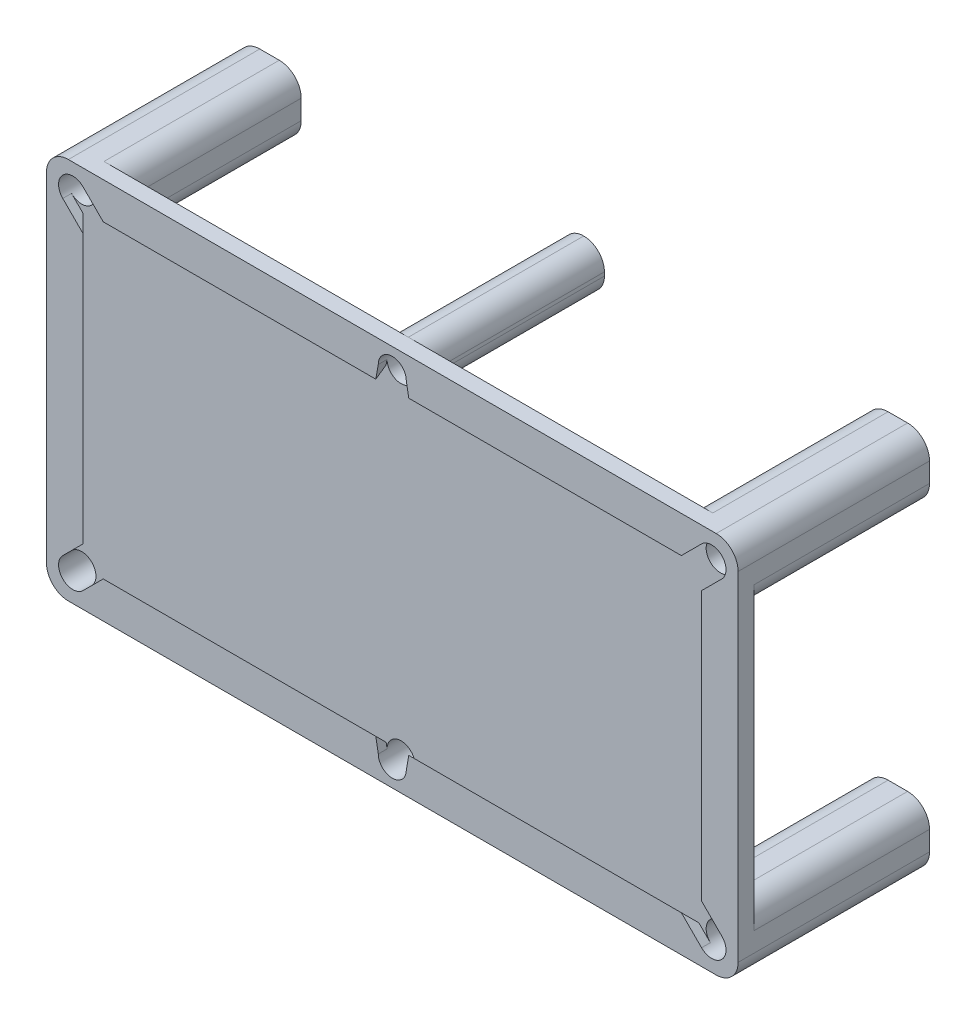
from build123d import *

# Parameters (mm, degrees)
SZKIC1_W                    = 2840
SZKIC1_H                    = 1570
SZKIC1_W_2                  = 2540
SZKIC1_H_2                  = 1270
DODANIE_WYCI_GNI_CIE1_DEPTH = 36
SFAZOWANIE1_SIZE            = 36
SZKIC3_W                    = 2840
SZKIC3_H                    = 1570
DODANIE_WYCI_GNI_CIE3_DEPTH = 30
SZKIC5_W                    = 260
SZKIC5_H                    = 260
DODANIE_WYCI_GNI_CIE4_DEPTH = 720
WYTNIJ_WYCI_GNI_CIE16_DEPTH = 36
SZKIC8_R                    = 58.75
WYTNIJ_WYCI_GNI_CIE17_DEPTH = 700
ZAOKR_GLENIE1_R             = 90
WYTNIJ_WYCI_GNI_CIE18_DEPTH = 36
SZKIC11_W                   = 170
SZKIC11_H                   = 185
DODANIE_WYCI_GNI_CIE5_DEPTH = 720
ZAOKR_GLENIE2_R             = 85
SZKIC10_R                   = 57.5
WYTNIJ_WYCI_GNI_CIE19_DEPTH = 700


with BuildPart() as part:
    # Szkic1 → Dodanie-wyciągnięcie1 (new body)
    with BuildSketch(Plane.XY):
        Rectangle(SZKIC1_W, SZKIC1_H)
        Rectangle(SZKIC1_W_2, SZKIC1_H_2, mode=Mode.SUBTRACT)
    extrude(amount=DODANIE_WYCI_GNI_CIE1_DEPTH)

    # Sfazowanie1
    sfazowanie1_edges = [part.edges().sort_by_distance(p)[0] for p in [
        (-1270, 0, 0),
        (0, -635, 0),
        (1270, 0, 0),
        (0, 635, 0),
    ]]
    chamfer(sfazowanie1_edges, length=SFAZOWANIE1_SIZE - 0.0001)  # a hair under: the kernel refuses the full size

    # Szkic3 → Dodanie-wyciągnięcie3 (add)
    with BuildSketch(Plane(origin=(0, 0, 0), x_dir=(-1, 0, 0), z_dir=(0, 0, -1))):
        Rectangle(SZKIC3_W, SZKIC3_H)
    extrude(amount=DODANIE_WYCI_GNI_CIE3_DEPTH)

    # Szkic5 → Dodanie-wyciągnięcie4 (add)
    with BuildSketch(Plane(origin=(0, 0, -30), x_dir=(-1, 0, 0), z_dir=(0, 0, -1))):
        with Locations((-1290, 655)):
            Rectangle(SZKIC5_W, SZKIC5_H)
        with Locations((1290, 655)):
            Rectangle(SZKIC5_W, SZKIC5_H)
        with Locations((1290, -655)):
            Rectangle(SZKIC5_W, SZKIC5_H)
        with Locations((-1290, -655)):
            Rectangle(SZKIC5_W, SZKIC5_H)
    extrude(amount=DODANIE_WYCI_GNI_CIE4_DEPTH)

    # Szkic4 → Wytnij-wyciągnięcie16 (cut)
    with BuildSketch(Plane.XY.offset(36)):
        with BuildLine():
            Line((-1270, 635), (-1186.914953211, 635))
            Line((-1186.914953211, 635), (-1270, 718.085046789))
            ThreePointArc((-1270, 718.085046789), (-1353.085046789, 718.085046789), (-1353.085046789, 635))
            Line((-1353.085046789, 635), (-1270, 551.914953211))
            Line((-1270, 551.914953211), (-1270, 635))
        make_face()
        with BuildLine():
            Line((1270, 718.085046789), (1186.914953211, 635))
            Line((1186.914953211, 635), (1270, 635))
            Line((1270, 635), (1270, 551.914953211))
            Line((1270, 551.914953211), (1353.085046789, 635))
            ThreePointArc((1353.085046789, 635), (1353.085046789, 718.085046789), (1270, 718.085046789))
        make_face()
        with BuildLine():
            Line((-1270, -635), (-1270, -551.914953211))
            Line((-1270, -551.914953211), (-1353.085046789, -635))
            ThreePointArc((-1353.085046789, -635), (-1353.085046789, -718.085046789), (-1270, -718.085046789))
            Line((-1270, -718.085046789), (-1186.914953211, -635))
            Line((-1186.914953211, -635), (-1270, -635))
        make_face()
        with BuildLine():
            Line((1353.085046789, -635), (1270, -551.914953211))
            Line((1270, -551.914953211), (1270, -635))
            Line((1270, -635), (1186.914953211, -635))
            Line((1186.914953211, -635), (1270, -718.085046789))
            ThreePointArc((1270, -718.085046789), (1353.085046789, -718.085046789), (1353.085046789, -635))
        make_face()
    extrude(amount=-WYTNIJ_WYCI_GNI_CIE16_DEPTH, mode=Mode.SUBTRACT)

    # Szkic8 → Wytnij-wyciągnięcie17 (cut)
    with BuildSketch(Plane.XY.offset(36)):
        with Locations((-1311.542523395, -676.542523395)):
            Circle(SZKIC8_R)
        with Locations((-1311.542523395, 676.542523395)):
            Circle(SZKIC8_R)
        with Locations((1311.542523395, 676.542523395)):
            Circle(SZKIC8_R)
        with Locations((1311.542523395, -676.542523395)):
            Circle(SZKIC8_R)
    extrude(amount=-WYTNIJ_WYCI_GNI_CIE17_DEPTH, mode=Mode.SUBTRACT)

    # Zaokrąglenie1
    zaokr_glenie1_edges = [part.edges().sort_by_distance(p)[0] for p in [
        (-1160, 525, -390),
        (-1160, -785, -390),
        (-1420, -785, -357),
        (-1160, -525, -390),
        (-1420, -525, -390),
        (-1420, 525, -390),
        (-1160, 785, -390),
        (-1420, 785, -357),
        (1160, -525, -390),
        (1420, -525, -390),
        (1420, -785, -357),
        (1160, -785, -390),
        (1160, 525, -390),
        (1160, 785, -390),
        (1420, 525, -390),
        (1420, 785, -357),
    ]]
    fillet(zaokr_glenie1_edges, radius=ZAOKR_GLENIE1_R)

    # Szkic9 → Wytnij-wyciągnięcie18 (cut)
    with BuildSketch(Plane.XY.offset(36)):
        with BuildLine():
            Line((-67.638801391, 635), (67.638801391, 635))
            Line((67.638801391, 635), (57.5, 692.5))
            ThreePointArc((57.5, 692.5), (0, 750), (-57.5, 692.5))
            Line((-57.5, 692.5), (-67.638801391, 635))
        make_face()
        with BuildLine():
            Line((-67.638801391, -635), (-57.5, -692.5))
            ThreePointArc((-57.5, -692.5), (0, -750), (57.5, -692.5))
            Line((57.5, -692.5), (67.638801391, -635))
            Line((67.638801391, -635), (-67.638801391, -635))
        make_face()
    extrude(amount=-WYTNIJ_WYCI_GNI_CIE18_DEPTH, mode=Mode.SUBTRACT)

    # Szkic11 → Dodanie-wyciągnięcie5 (add)
    with BuildSketch(Plane(origin=(0, 0, -30), x_dir=(-1, 0, 0), z_dir=(0, 0, -1))):
        with Locations((0, 692.5)):
            Rectangle(SZKIC11_W, SZKIC11_H)
        with Locations((0, -692.5)):
            Rectangle(SZKIC11_W, SZKIC11_H)
    extrude(amount=DODANIE_WYCI_GNI_CIE5_DEPTH)

    # Zaokrąglenie2
    zaokr_glenie2_edges = [part.edges().sort_by_distance(p)[0] for p in [
        (85, -785, -390),
        (85, -600, -390),
        (-85, -600, -390),
        (-85, -785, -390),
        (-85, 600, -390),
        (85, 600, -390),
        (85, 785, -390),
        (-85, 785, -390),
    ]]
    fillet(zaokr_glenie2_edges, radius=ZAOKR_GLENIE2_R - 0.0001)  # a hair under: the kernel refuses the full size

    # Szkic10 → Wytnij-wyciągnięcie19 (cut)
    with BuildSketch(Plane.XY.offset(36)):
        with Locations((0, 692.5)):
            Circle(SZKIC10_R)
        with Locations((0, -692.5)):
            Circle(SZKIC10_R)
    extrude(amount=-WYTNIJ_WYCI_GNI_CIE19_DEPTH, mode=Mode.SUBTRACT)


solid = part.part
